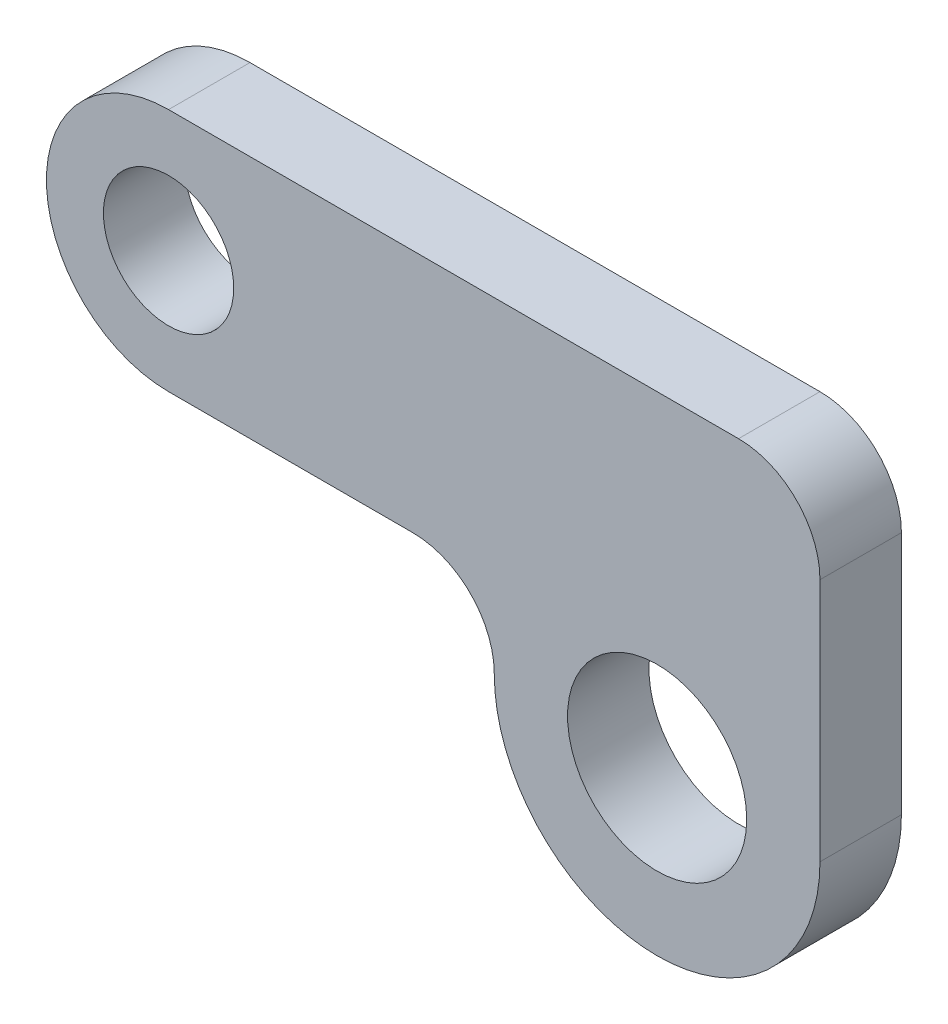
from build123d import *

# Parameters (mm, degrees)
SKETCH_1_R       = 4
SKETCH_1_R_2     = 5.5
EXTRUDE_1_DEPTH  = 5
FILLET_1_DEPTH   = 5
FILLET_1_2_DEPTH = 5


with BuildPart() as part:
    # 草图1 → 凸台-拉伸1 (new body)
    with BuildSketch(Plane.XY):
        with BuildLine():
            Line((-30, -7.5), (-10, -7.5))
            Line((-10, -7.5), (-10, -12.5))
            ThreePointArc((-10, -12.5), (0, -22.5), (10, -12.5))
            Line((10, -12.5), (10, 7.5))
            Line((10, 7.5), (-30, 7.5))
            ThreePointArc((-30, 7.5), (-37.5, 0), (-30, -7.5))
        make_face()
        with Locations((-30, 0)):
            Circle(SKETCH_1_R, mode=Mode.SUBTRACT)
        with Locations((0, -12.5)):
            Circle(SKETCH_1_R_2, mode=Mode.SUBTRACT)
    extrude(amount=EXTRUDE_1_DEPTH)

    # 圆角1: read off the stored shape, not the designer's step
    # 圆角1 outline → 圆角1 (cut)
    with BuildSketch(Plane.XY):
        with BuildLine():
            Line((10, 7.5), (5, 7.5))
            ThreePointArc((5, 7.5), (8.535533906, 6.035533906), (10, 2.5))
            Line((10, 2.5), (10, 7.5))
        make_face()
    extrude(amount=FILLET_1_DEPTH, mode=Mode.SUBTRACT)

    # Fillet 1 2 outline → Fillet 1 2 (add)
    with BuildSketch(Plane.XY):
        with BuildLine():
            ThreePointArc((-15, -7.5), (-11.464466094, -8.964466094), (-10, -12.5))
            Line((-10, -12.5), (-10, -7.5))
            Line((-10, -7.5), (-15, -7.5))
        make_face()
    extrude(amount=FILLET_1_2_DEPTH)


solid = part.part
